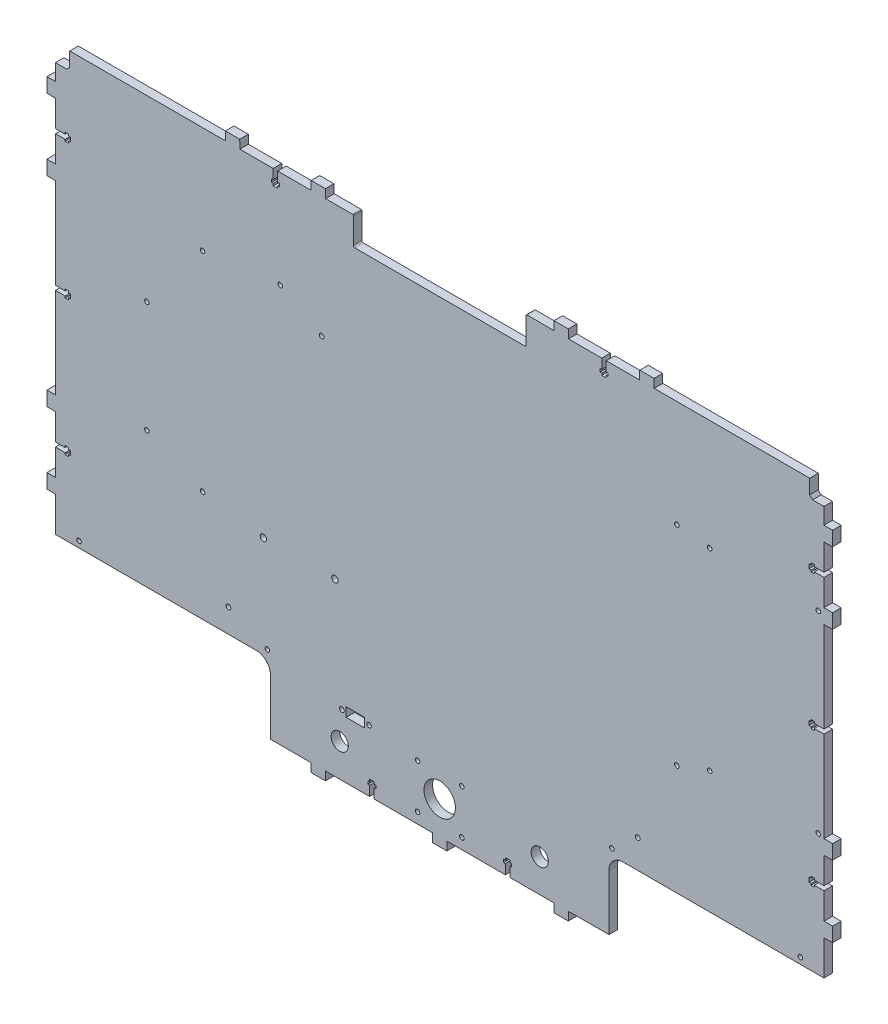
from build123d import *

# Parameters (mm, degrees)
SKETCH_1_R      = 1.6
SKETCH_1_R_2    = 1.7
SKETCH_1_R_3    = 6
SKETCH_1_W      = 13
SKETCH_1_H      = 6.5
SKETCH_1_R_4    = 1.626470027
SKETCH_1_R_5    = 2.25
SKETCH_1_R_6    = 11
EXTRUDE_1_DEPTH = 6


with BuildPart() as part:
    # Эскиз1 → Бобышка-Вытянуть1 (new body)
    with BuildSketch(Plane.XY):
        with BuildLine():
            Line((89.741925364, 539.042043616), (89.741925364, 500.137589553))
            Line((89.741925364, 500.137589553), (118.091925364, 500.137589553))
            Line((118.091925364, 500.137589553), (118.191925364, 494.137589553))
            Line((118.191925364, 494.137589553), (128.191925364, 494.137589553))
            Line((128.191925364, 494.137589553), (128.291925364, 500.137589553))
            Line((128.291925364, 500.137589553), (159.141925364, 500.137589553))
            Line((159.141925364, 500.137589553), (159.141925364, 506.937589553))
            Line((159.141925364, 506.937589553), (157.941925364, 506.937589553))
            Line((157.941925364, 506.937589553), (157.941925364, 509.137589553))
            Line((157.941925364, 509.137589553), (159.141925364, 509.137589553))
            Line((159.141925364, 509.137589553), (159.141925364, 510.637589553))
            Line((159.141925364, 510.637589553), (162.241925364, 510.637589553))
            Line((162.241925364, 510.637589553), (162.241925364, 509.137589553))
            Line((162.241925364, 509.137589553), (163.441925364, 509.137589553))
            Line((163.441925364, 509.137589553), (163.441925364, 506.937589553))
            Line((163.441925364, 506.937589553), (162.241925364, 506.937589553))
            Line((162.241925364, 506.937589553), (162.241925364, 500.137589553))
            Line((162.241925364, 500.137589553), (203.091925364, 500.137589553))
            Line((203.091925364, 500.137589553), (203.191925364, 494.137589553))
            Line((203.191925364, 494.137589553), (213.191925364, 494.137589553))
            Line((213.191925364, 494.137589553), (213.291925364, 500.137589553))
            Line((213.291925364, 500.137589553), (254.141925364, 500.137589553))
            Line((254.141925364, 500.137589553), (254.141925364, 506.937589553))
            Line((254.141925364, 506.937589553), (252.941925364, 506.937589553))
            Line((252.941925364, 506.937589553), (252.941925364, 509.137589553))
            Line((252.941925364, 509.137589553), (254.141925364, 509.137589553))
            Line((254.141925364, 509.137589553), (254.141925364, 510.637589553))
            Line((254.141925364, 510.637589553), (257.241925364, 510.637589553))
            Line((257.241925364, 510.637589553), (257.241925364, 509.137589553))
            Line((257.241925364, 509.137589553), (258.441925364, 509.137589553))
            Line((258.441925364, 509.137589553), (258.441925364, 506.937589553))
            Line((258.441925364, 506.937589553), (257.241925364, 506.937589553))
            Line((257.241925364, 506.937589553), (257.241925364, 500.137589553))
            Line((257.241925364, 500.137589553), (288.091925364, 500.137589553))
            Line((288.091925364, 500.137589553), (288.191925364, 494.137589553))
            Line((288.191925364, 494.137589553), (298.191925364, 494.137589553))
            Line((298.191925364, 494.137589553), (298.291925364, 500.137589553))
            Line((298.291925364, 500.137589553), (326.641925364, 500.137589553))
            Line((326.641925364, 500.137589553), (326.641925364, 539.137589553))
            ThreePointArc((326.641925364, 539.137589553), (329.570857552, 546.208657365), (336.641925364, 549.137589553))
            Line((336.641925364, 549.137589553), (377.191925364, 549.137589553))
            Line((377.191925364, 549.137589553), (477.191925364, 549.137589553))
            Line((477.191925364, 549.137589553), (477.191925364, 573.442043616))
            Line((477.191925364, 573.442043616), (483.191925364, 573.542043616))
            Line((483.191925364, 573.542043616), (483.191925364, 583.542043616))
            Line((483.191925364, 583.542043616), (477.191925364, 583.642043616))
            Line((477.191925364, 583.642043616), (477.191925364, 601.992043616))
            Line((477.191925364, 601.992043616), (470.391925364, 601.992043616))
            Line((470.391925364, 601.992043616), (470.391925364, 600.792043616))
            Line((470.391925364, 600.792043616), (468.191925364, 600.792043616))
            Line((468.191925364, 600.792043616), (468.191925364, 601.992043616))
            Line((468.191925364, 601.992043616), (466.691925364, 601.992043616))
            Line((466.691925364, 601.992043616), (466.691925364, 605.092043616))
            Line((466.691925364, 605.092043616), (468.191925364, 605.092043616))
            Line((468.191925364, 605.092043616), (468.191925364, 606.292043616))
            Line((468.191925364, 606.292043616), (470.391925364, 606.292043616))
            Line((470.391925364, 606.292043616), (470.391925364, 605.092043616))
            Line((470.391925364, 605.092043616), (477.191925364, 605.092043616))
            Line((477.191925364, 605.092043616), (477.191925364, 623.442043616))
            Line((477.191925364, 623.442043616), (483.191925364, 623.542043616))
            Line((483.191925364, 623.542043616), (483.191925364, 633.542043616))
            Line((483.191925364, 633.542043616), (477.191925364, 633.642043616))
            Line((477.191925364, 633.642043616), (477.191925364, 696.992043616))
            Line((477.191925364, 696.992043616), (470.391925364, 696.992043616))
            Line((470.391925364, 696.992043616), (470.391925364, 695.792043616))
            Line((470.391925364, 695.792043616), (468.191925364, 695.792043616))
            Line((468.191925364, 695.792043616), (468.191925364, 696.992043616))
            Line((468.191925364, 696.992043616), (466.691925364, 696.992043616))
            Line((466.691925364, 696.992043616), (466.691925364, 700.092043616))
            Line((466.691925364, 700.092043616), (468.191925364, 700.092043616))
            Line((468.191925364, 700.092043616), (468.191925364, 701.292043616))
            Line((468.191925364, 701.292043616), (470.391925364, 701.292043616))
            Line((470.391925364, 701.292043616), (470.391925364, 700.092043616))
            Line((470.391925364, 700.092043616), (477.191925364, 700.092043616))
            Line((477.191925364, 700.092043616), (477.191925364, 763.442043616))
            Line((477.191925364, 763.442043616), (483.191925364, 763.542043616))
            Line((483.191925364, 763.542043616), (483.191925364, 773.542043616))
            Line((483.191925364, 773.542043616), (477.191925364, 773.642043616))
            Line((477.191925364, 773.642043616), (477.191925364, 791.992043616))
            Line((477.191925364, 791.992043616), (470.391925364, 791.992043616))
            Line((470.391925364, 791.992043616), (470.391925364, 790.792043616))
            Line((470.391925364, 790.792043616), (468.191925364, 790.792043616))
            Line((468.191925364, 790.792043616), (468.191925364, 791.992043616))
            Line((468.191925364, 791.992043616), (466.691925364, 791.992043616))
            Line((466.691925364, 791.992043616), (466.691925364, 795.092043616))
            Line((466.691925364, 795.092043616), (468.191925364, 795.092043616))
            Line((468.191925364, 795.092043616), (468.191925364, 796.292043616))
            Line((468.191925364, 796.292043616), (470.391925364, 796.292043616))
            Line((470.391925364, 796.292043616), (470.391925364, 795.092043616))
            Line((470.391925364, 795.092043616), (477.191925364, 795.092043616))
            Line((477.191925364, 795.092043616), (477.191925364, 813.442043616))
            Line((477.191925364, 813.442043616), (483.191925364, 813.542043616))
            Line((483.191925364, 813.542043616), (483.191925364, 823.542043616))
            Line((483.191925364, 823.542043616), (477.191925364, 823.642043616))
            Line((477.191925364, 823.642043616), (477.191925364, 835.042043616))
            Line((477.191925364, 835.042043616), (469.191925364, 835.042043616))
            Line((469.191925364, 835.042043616), (467.191925364, 837.042043616))
            Line((467.191925364, 837.042043616), (467.191925364, 847.042043616))
            Line((467.191925364, 847.042043616), (467.191925364, 847.137589553))
            Line((467.191925364, 847.137589553), (367.191925364, 847.137589553))
            Line((367.191925364, 847.137589553), (358.291925364, 847.137589553))
            Line((358.291925364, 847.137589553), (358.191925364, 853.137589553))
            Line((358.191925364, 853.137589553), (348.191925364, 853.137589553))
            Line((348.191925364, 853.137589553), (348.091925364, 847.137589553))
            Line((348.091925364, 847.137589553), (324.741925364, 847.137589553))
            Line((324.741925364, 847.137589553), (324.741925364, 840.337589553))
            Line((324.741925364, 840.337589553), (325.941925364, 840.337589553))
            Line((325.941925364, 840.337589553), (325.941925364, 838.137589553))
            Line((325.941925364, 838.137589553), (324.741925364, 838.137589553))
            Line((324.741925364, 838.137589553), (324.741925364, 836.637589553))
            Line((324.741925364, 836.637589553), (321.641925364, 836.637589553))
            Line((321.641925364, 836.637589553), (321.641925364, 838.137589553))
            Line((321.641925364, 838.137589553), (320.441925364, 838.137589553))
            Line((320.441925364, 838.137589553), (320.441925364, 840.337589553))
            Line((320.441925364, 840.337589553), (321.641925364, 840.337589553))
            Line((321.641925364, 840.337589553), (321.641925364, 847.137589553))
            Line((321.641925364, 847.137589553), (298.291925364, 847.137589553))
            Line((298.291925364, 847.137589553), (298.191925364, 853.137589553))
            Line((298.191925364, 853.137589553), (288.191925364, 853.137589553))
            Line((288.191925364, 853.137589553), (288.091925364, 847.137589553))
            Line((288.091925364, 847.137589553), (269.191925364, 847.137589553))
            ThreePointArc((269.191925364, 847.137589553), (268.838371974, 846.991142943), (268.691925364, 846.637589553))
            Line((268.691925364, 846.637589553), (268.691925364, 828.542043616))
            ThreePointArc((268.691925364, 828.542043616), (268.399032145, 827.834936835), (267.691925364, 827.542043616))
            Line((267.691925364, 827.542043616), (148.691925364, 827.542043616))
            ThreePointArc((148.691925364, 827.542043616), (147.984818583, 827.834936835), (147.691925364, 828.542043616))
            Line((147.691925364, 828.542043616), (147.691925364, 846.542043616))
            Line((147.691925364, 846.542043616), (147.691925364, 846.637589553))
            ThreePointArc((147.691925364, 846.637589553), (147.545478755, 846.991142943), (147.191925364, 847.137589553))
            Line((147.191925364, 847.137589553), (128.291925364, 847.137589553))
            Line((128.291925364, 847.137589553), (128.191925364, 853.137589553))
            Line((128.191925364, 853.137589553), (118.191925364, 853.137589553))
            Line((118.191925364, 853.137589553), (118.091925364, 847.137589553))
            Line((118.091925364, 847.137589553), (94.741925364, 847.137589553))
            Line((94.741925364, 847.137589553), (94.741925364, 840.337589553))
            Line((94.741925364, 840.337589553), (95.941925364, 840.337589553))
            Line((95.941925364, 840.337589553), (95.941925364, 838.137589553))
            Line((95.941925364, 838.137589553), (94.741925364, 838.137589553))
            Line((94.741925364, 838.137589553), (94.741925364, 838.042043616))
            Line((94.741925364, 838.042043616), (94.741925364, 836.637589553))
            Line((94.741925364, 836.637589553), (94.741925364, 836.542043616))
            Line((94.741925364, 836.542043616), (91.641925364, 836.542043616))
            Line((91.641925364, 836.542043616), (91.641925364, 836.637589553))
            Line((91.641925364, 836.637589553), (91.641925364, 838.042043616))
            Line((91.641925364, 838.042043616), (91.641925364, 838.137589553))
            Line((91.641925364, 838.137589553), (90.441925364, 838.137589553))
            Line((90.441925364, 838.137589553), (90.441925364, 840.337589553))
            Line((90.441925364, 840.337589553), (91.641925364, 840.337589553))
            Line((91.641925364, 840.337589553), (91.641925364, 847.137589553))
            Line((91.641925364, 847.137589553), (68.291925364, 847.137589553))
            Line((68.291925364, 847.137589553), (68.191925364, 853.137589553))
            Line((68.191925364, 853.137589553), (58.191925364, 853.137589553))
            Line((58.191925364, 853.137589553), (58.091925364, 847.137589553))
            Line((58.091925364, 847.137589553), (49.191925364, 847.137589553))
            Line((49.191925364, 847.137589553), (-50.808074636, 847.137589553))
            Line((-50.808074636, 847.137589553), (-50.808074636, 847.042043616))
            Line((-50.808074636, 847.042043616), (-50.808074636, 837.042043616))
            Line((-50.808074636, 837.042043616), (-52.808074636, 835.042043616))
            Line((-52.808074636, 835.042043616), (-60.808074636, 835.042043616))
            Line((-60.808074636, 835.042043616), (-60.808074636, 823.642043616))
            Line((-60.808074636, 823.642043616), (-66.808074636, 823.542043616))
            Line((-66.808074636, 823.542043616), (-66.808074636, 813.542043616))
            Line((-66.808074636, 813.542043616), (-60.808074636, 813.442043616))
            Line((-60.808074636, 813.442043616), (-60.808074636, 795.092043616))
            Line((-60.808074636, 795.092043616), (-54.008074636, 795.092043616))
            Line((-54.008074636, 795.092043616), (-54.008074636, 796.292043616))
            Line((-54.008074636, 796.292043616), (-51.808074636, 796.292043616))
            Line((-51.808074636, 796.292043616), (-51.808074636, 795.092043616))
            Line((-51.808074636, 795.092043616), (-50.308074636, 795.092043616))
            Line((-50.308074636, 795.092043616), (-50.308074636, 791.992043616))
            Line((-50.308074636, 791.992043616), (-51.808074636, 791.992043616))
            Line((-51.808074636, 791.992043616), (-51.808074636, 790.792043616))
            Line((-51.808074636, 790.792043616), (-54.008074636, 790.792043616))
            Line((-54.008074636, 790.792043616), (-54.008074636, 791.992043616))
            Line((-54.008074636, 791.992043616), (-60.808074636, 791.992043616))
            Line((-60.808074636, 791.992043616), (-60.808074636, 773.642043616))
            Line((-60.808074636, 773.642043616), (-66.808074636, 773.542043616))
            Line((-66.808074636, 773.542043616), (-66.808074636, 763.542043616))
            Line((-66.808074636, 763.542043616), (-60.808074636, 763.442043616))
            Line((-60.808074636, 763.442043616), (-60.808074636, 700.092043616))
            Line((-60.808074636, 700.092043616), (-54.008074636, 700.092043616))
            Line((-54.008074636, 700.092043616), (-54.008074636, 701.292043616))
            Line((-54.008074636, 701.292043616), (-51.808074636, 701.292043616))
            Line((-51.808074636, 701.292043616), (-51.808074636, 700.092043616))
            Line((-51.808074636, 700.092043616), (-50.308074636, 700.092043616))
            Line((-50.308074636, 700.092043616), (-50.308074636, 696.992043616))
            Line((-50.308074636, 696.992043616), (-51.808074636, 696.992043616))
            Line((-51.808074636, 696.992043616), (-51.808074636, 695.792043616))
            Line((-51.808074636, 695.792043616), (-54.008074636, 695.792043616))
            Line((-54.008074636, 695.792043616), (-54.008074636, 696.992043616))
            Line((-54.008074636, 696.992043616), (-60.808074636, 696.992043616))
            Line((-60.808074636, 696.992043616), (-60.808074636, 633.642043616))
            Line((-60.808074636, 633.642043616), (-66.808074636, 633.542043616))
            Line((-66.808074636, 633.542043616), (-66.808074636, 623.542043616))
            Line((-66.808074636, 623.542043616), (-60.808074636, 623.442043616))
            Line((-60.808074636, 623.442043616), (-60.808074636, 605.092043616))
            Line((-60.808074636, 605.092043616), (-54.008074636, 605.092043616))
            Line((-54.008074636, 605.092043616), (-54.008074636, 606.292043616))
            Line((-54.008074636, 606.292043616), (-51.808074636, 606.292043616))
            Line((-51.808074636, 606.292043616), (-51.808074636, 605.092043616))
            Line((-51.808074636, 605.092043616), (-50.308074636, 605.092043616))
            Line((-50.308074636, 605.092043616), (-50.308074636, 601.992043616))
            Line((-50.308074636, 601.992043616), (-51.808074636, 601.992043616))
            Line((-51.808074636, 601.992043616), (-51.808074636, 600.792043616))
            Line((-51.808074636, 600.792043616), (-54.008074636, 600.792043616))
            Line((-54.008074636, 600.792043616), (-54.008074636, 601.992043616))
            Line((-54.008074636, 601.992043616), (-60.808074636, 601.992043616))
            Line((-60.808074636, 601.992043616), (-60.808074636, 583.642043616))
            Line((-60.808074636, 583.642043616), (-66.808074636, 583.542043616))
            Line((-66.808074636, 583.542043616), (-66.808074636, 573.542043616))
            Line((-66.808074636, 573.542043616), (-60.808074636, 573.442043616))
            Line((-60.808074636, 573.442043616), (-60.808074636, 549.042043616))
            Line((-60.808074636, 549.042043616), (39.191925364, 549.042043616))
            Line((39.191925364, 549.042043616), (79.741925364, 549.042043616))
            ThreePointArc((79.741925364, 549.042043616), (86.812993176, 546.113111428), (89.741925364, 539.042043616))
        make_face()
        with Locations((-44.258074636, 553.442043616)):
            Circle(SKETCH_1_R, mode=Mode.SUBTRACT)
        with Locations((60.306923435, 565.643369962)):
            Circle(SKETCH_1_R_2, mode=Mode.SUBTRACT)
        with Locations((138.191925364, 523.137589553)):
            Circle(SKETCH_1_R_3, mode=Mode.SUBTRACT)
        with Locations((192.691925364, 507.637589553)):
            Circle(SKETCH_1_R, mode=Mode.SUBTRACT)
        with Locations((192.691925364, 538.637589553)):
            Circle(SKETCH_1_R, mode=Mode.SUBTRACT)
        with Locations((87.541925364, 553.442043616)):
            Circle(SKETCH_1_R, mode=Mode.SUBTRACT)
        with Locations((139.700153258, 543.137589553)):
            Circle(SKETCH_1_R_2, mode=Mode.SUBTRACT)
        with Locations((149.200153258, 543.147589553)):
            Rectangle(SKETCH_1_W, SKETCH_1_H, mode=Mode.SUBTRACT)
        with Locations((158.700153258, 543.137589553)):
            Circle(SKETCH_1_R_4, mode=Mode.SUBTRACT)
        with Locations((42.191925364, 626.492043616)):
            Circle(SKETCH_1_R, mode=Mode.SUBTRACT)
        with Locations((3.191925364, 644.137589553)):
            Circle(SKETCH_1_R, mode=Mode.SUBTRACT)
        with Locations((84.78568386, 619.788752578)):
            Circle(SKETCH_1_R_5, mode=Mode.SUBTRACT)
        with Locations((134.78568386, 619.788752578)):
            Circle(SKETCH_1_R_5, mode=Mode.SUBTRACT)
        with Locations((223.691925364, 507.637589553)):
            Circle(SKETCH_1_R, mode=Mode.SUBTRACT)
        with Locations((208.191925364, 523.137589553)):
            Circle(SKETCH_1_R_6, mode=Mode.SUBTRACT)
        with Locations((223.691925364, 538.637589553)):
            Circle(SKETCH_1_R, mode=Mode.SUBTRACT)
        with Locations((278.191925364, 523.137589553)):
            Circle(SKETCH_1_R_3, mode=Mode.SUBTRACT)
        with Locations((328.741925364, 553.537589553)):
            Circle(SKETCH_1_R, mode=Mode.SUBTRACT)
        with Locations((346.784706522, 569.071596444)):
            Circle(SKETCH_1_R_2, mode=Mode.SUBTRACT)
        with Locations((460.641925364, 553.537589553)):
            Circle(SKETCH_1_R, mode=Mode.SUBTRACT)
        with Locations((374.191925364, 626.492043616)):
            Circle(SKETCH_1_R, mode=Mode.SUBTRACT)
        with Locations((397.191925363, 634.750548648)):
            Circle(SKETCH_1_R, mode=Mode.SUBTRACT)
        with Locations((473.191925363, 634.750548648)):
            Circle(SKETCH_1_R, mode=Mode.SUBTRACT)
        with Locations((3.191925364, 722.137589553)):
            Circle(SKETCH_1_R, mode=Mode.SUBTRACT)
        with Locations((125.560359077, 762.493723785)):
            Circle(SKETCH_1_R, mode=Mode.SUBTRACT)
        with Locations((42.191925364, 772.492043616)):
            Circle(SKETCH_1_R, mode=Mode.SUBTRACT)
        with Locations((96.560359077, 778.91114809)):
            Circle(SKETCH_1_R, mode=Mode.SUBTRACT)
        with Locations((374.191925364, 772.492043616)):
            Circle(SKETCH_1_R, mode=Mode.SUBTRACT)
        with Locations((397.191925363, 769.750548648)):
            Circle(SKETCH_1_R, mode=Mode.SUBTRACT)
        with Locations((473.191925363, 769.750548648)):
            Circle(SKETCH_1_R, mode=Mode.SUBTRACT)
    extrude(amount=EXTRUDE_1_DEPTH)


solid = part.part
